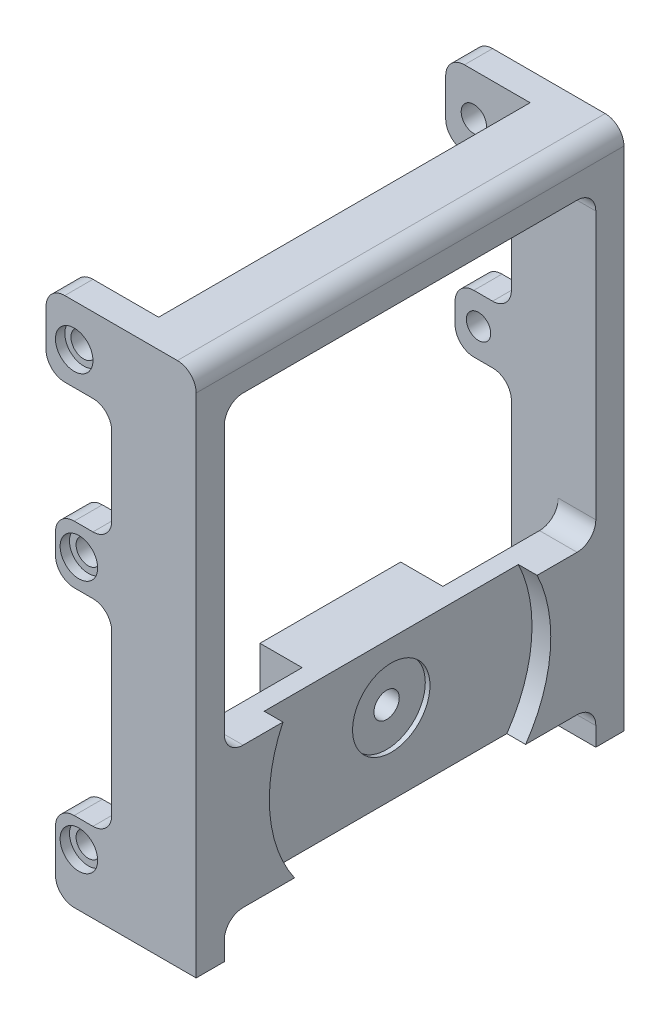
from build123d import *

# Parameters (mm, degrees)
BOSS_EXTRUDE1_DEPTH = 3
SKETCH2_R           = 1.35
SKETCH2_R_2         = 1.3
CUT_EXTRUDE1_DEPTH  = 59.051701095
SKETCH3_W           = 7
SKETCH3_H           = 4.5
BOSS_EXTRUDE2_DEPTH = 19.8
SKETCH4_W           = 4
SKETCH4_H           = 15
BOSS_EXTRUDE3_DEPTH = 19.8
CUT_EXTRUDE2_DEPTH  = 2
SKETCH7_R           = 4.125
CUT_EXTRUDE3_DEPTH  = 0.5
SKETCH9_W           = 7.5
SKETCH9_H           = 15
BOSS_EXTRUDE4_DEPTH = 4.5
SKETCH12_R          = 1.35
CUT_EXTRUDE4_DEPTH  = 62.742125004
SKETCH13_W          = 3
SKETCH13_H          = 8
BOSS_EXTRUDE5_DEPTH = 1
FILLET1_R           = 2
SKETCH14_R          = 2
CUT_EXTRUDE5_DEPTH  = 1


with BuildPart() as part:
    # Sketch1 → Boss-Extrude1 (new body)
    with BuildSketch(Plane.XY):
        Polygon((0, 48), (6, 48), (6, 35.68), (0, 35.68), (0, 29.52), (6, 29.52), (6, 8.5), (0, 8.5), (0, 0), (15, 0), (15, 56), (0, 56), align=None)
    extrude(amount=BOSS_EXTRUDE1_DEPTH)

    # Sketch2 → Cut-Extrude1 (cut, through all)
    with BuildSketch(Plane.XY.offset(3)):
        with Locations((2, 51.5)):
            Circle(SKETCH2_R)
        with Locations((2.5, 5.6)):
            Circle(SKETCH2_R_2)
        with Locations((2.5, 32.6)):
            Circle(SKETCH2_R_2)
    extrude(amount=-CUT_EXTRUDE1_DEPTH, mode=Mode.SUBTRACT)

    # Sketch3 → Boss-Extrude2 (add)
    with BuildSketch(Plane.XY.offset(3)):
        with Locations((11.5, 53.75)):
            Rectangle(SKETCH3_W, SKETCH3_H)
    extrude(amount=BOSS_EXTRUDE2_DEPTH)

    # Sketch4 → Boss-Extrude3 (add)
    with BuildSketch(Plane.XY.offset(3)):
        with Locations((13, 11.5)):
            Rectangle(SKETCH4_W, SKETCH4_H)
    extrude(amount=BOSS_EXTRUDE3_DEPTH)

    # Sketch5 → Cut-Extrude2 (cut)
    with BuildSketch(Plane(origin=(15, 0, 0), x_dir=(0, 0, -1), z_dir=(1, 0, 0))):
        with BuildLine():
            Line((-9.252808409, 19), (-22.8, 19))
            Line((-22.8, 19), (-22.8, 4))
            Line((-22.8, 4), (-22.8, -2.44))
            ThreePointArc((-22.8, -2.44), (-12.193398282, 1.953398282), (-7.8, 12.56))
            ThreePointArc((-7.8, 12.56), (-8.167709102, 15.860918519), (-9.252808409, 19))
        make_face()
    extrude(amount=-CUT_EXTRUDE2_DEPTH, mode=Mode.SUBTRACT)

    # Sketch7 → Cut-Extrude3 (cut)
    with BuildSketch(Plane(origin=(13, 0, 0), x_dir=(0, 0, -1), z_dir=(1, 0, 0))):
        with Locations((-22.8, 12.56)):
            Circle(SKETCH7_R)
    extrude(amount=-CUT_EXTRUDE3_DEPTH, mode=Mode.SUBTRACT)

    # Sketch9 → Boss-Extrude4 (add)
    with BuildSketch(Plane.ZY.offset(-11)):
        with Locations((19.05, 11.5)):
            Rectangle(SKETCH9_W, SKETCH9_H)
    extrude(amount=BOSS_EXTRUDE4_DEPTH)

    # Sketch12 → Cut-Extrude4 (cut, through all)
    with BuildSketch(Plane(origin=(12.5, 0, 0), x_dir=(0, 0, -1), z_dir=(1, 0, 0))):
        with Locations((-22.8, 12.56)):
            Circle(SKETCH12_R)
    extrude(amount=-CUT_EXTRUDE4_DEPTH, mode=Mode.SUBTRACT)

    # Sketch13 → Boss-Extrude5 (add)
    with BuildSketch(Plane.ZY):
        with Locations((1.5, 52)):
            Rectangle(SKETCH13_W, SKETCH13_H)
    extrude(amount=BOSS_EXTRUDE5_DEPTH)

    # Fillet1
    fillet1_edges = [part.edges().sort_by_distance(p)[0] for p in [
        (6, 8.5, 1.5),
        (6, 29.52, 1.5),
        (6, 35.68, 1.5),
        (6, 48, 1.5),
        (11.5, 51.5, 3),
        (13, 4, 3),
        (13, 19, 3),
    ]]
    fillet(fillet1_edges, radius=FILLET1_R)
    fillet1_2_edges = [part.edges().sort_by_distance(p)[0] for p in [
        (0, 8.5, 1.5),
        (0, 29.52, 1.5),
        (0, 35.68, 1.5),
        (15, 56, 11.4),
        (0, 0, 1.5),
        (-1, 56, 1.5),
        (-1, 48, 1.5),
    ]]
    fillet(fillet1_2_edges, radius=FILLET1_R)

    # Mirror1: part across plane


with BuildPart() as part_1:
    add(part.part)
    add(part.part.mirror(Plane.XY.offset(22.8)))

    # Sketch14 → Cut-Extrude5 (cut)
    with BuildSketch(Plane(origin=(0, 0, 0), x_dir=(-1, 0, 0), z_dir=(0, 0, -1))):
        with Locations((-2, 51.5)):
            Circle(SKETCH14_R)
        with Locations((-2.5, 32.6)):
            Circle(SKETCH14_R)
        with Locations((-2.5, 5.6)):
            Circle(SKETCH14_R)
    cut_extrude5 = extrude(amount=-CUT_EXTRUDE5_DEPTH, mode=Mode.SUBTRACT)

    # Mirror2: Cut-Extrude5 across plane
    add(cut_extrude5.mirror(Plane(origin=(0, 0, 22.8), x_dir=(1, 0, 0), z_dir=(0, 0, -1))), mode=Mode.SUBTRACT)


solid = part_1.part
